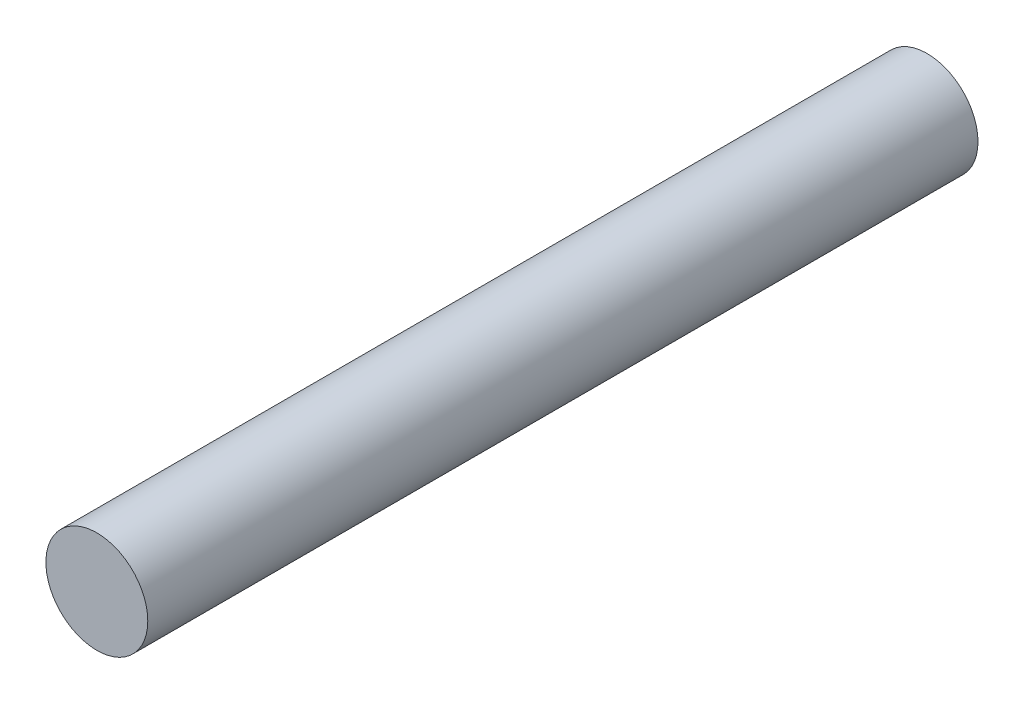
from build123d import *

# Parameters (mm, degrees)
SKETCH1_R           = 3.175
BOSS_EXTRUDE1_DEPTH = 51.74742


with BuildPart() as part:
    # Sketch1 → Boss-Extrude1 (new body)
    with BuildSketch(Plane.XY):
        Circle(SKETCH1_R)
    extrude(amount=BOSS_EXTRUDE1_DEPTH)


solid = part.part
